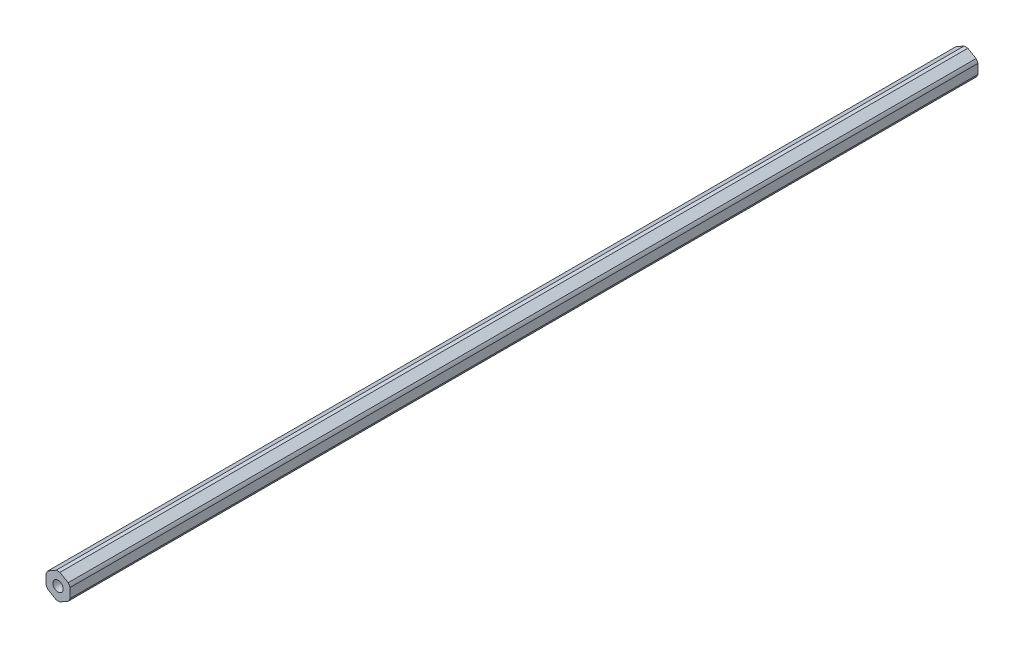
from build123d import *

# Parameters (mm, degrees)
BOSS_EXTRUDE1_DEPTH = 179.5145
SKETCH2_R           = 2.0193
CUT_EXTRUDE1_DEPTH  = 360.097159376


with BuildPart() as part:
    # Sketch1 → Boss-Extrude1 (new, symmetric)
    with BuildSketch(Plane.XY):
        with BuildLine():
            ThreePointArc((0.741687844, 5.071047637), (0, 5.125), (-0.741687844, 5.071047637))
            Line((-0.741687844, 5.071047637), (-4.020812156, 3.177844334))
            ThreePointArc((-4.020812156, 3.177844334), (-4.438380194, 2.5625), (-4.7625, 1.893203304))
            Line((-4.7625, 1.893203304), (-4.7625, -1.893203304))
            ThreePointArc((-4.7625, -1.893203304), (-4.438380194, -2.5625), (-4.020812156, -3.177844334))
            Line((-4.020812156, -3.177844334), (-0.741687844, -5.071047637))
            ThreePointArc((-0.741687844, -5.071047637), (0, -5.125), (0.741687844, -5.071047637))
            Line((0.741687844, -5.071047637), (4.020812156, -3.177844334))
            ThreePointArc((4.020812156, -3.177844334), (4.438380194, -2.5625), (4.7625, -1.893203304))
            Line((4.7625, -1.893203304), (4.7625, 1.893203304))
            ThreePointArc((4.7625, 1.893203304), (4.438380194, 2.5625), (4.020812156, 3.177844334))
            Line((4.020812156, 3.177844334), (0.741687844, 5.071047637))
        make_face()
    extrude(amount=BOSS_EXTRUDE1_DEPTH, both=True)

    # Sketch2 → Cut-Extrude1 (cut, through all)
    with BuildSketch(Plane.XY.offset(179.5145)):
        Circle(SKETCH2_R)
    extrude(amount=-CUT_EXTRUDE1_DEPTH, mode=Mode.SUBTRACT)


solid = part.part
